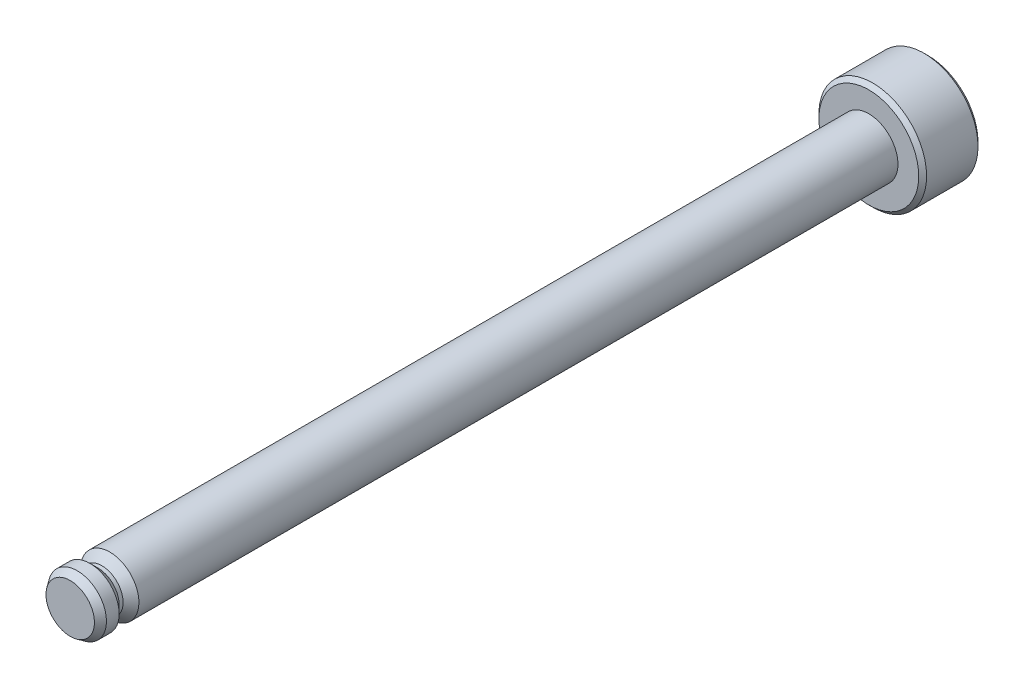
from build123d import *

# Parameters (mm, degrees)
SKETCH2_R      = 1.475
SHAFT_DEPTH    = 40.4
SKETCH5_R      = 2.725
HEAD_DEPTH     = 3
CHAMFER1_SIZE  = 0.25
CHAMFER1_SIZE2 = 0.357037002
DEBURS_SIZE    = 0.2


with BuildPart() as part:
    # Sketch2 → Shaft (new body)
    with BuildSketch(Plane.XY):
        Circle(SKETCH2_R)
    extrude(amount=SHAFT_DEPTH)

    # Sketch5 → Head (add)
    with BuildSketch(Plane.XY):
        Circle(SKETCH5_R)
    extrude(amount=-HEAD_DEPTH)

    # Chamfer1
    chamfer1_edges = [part.edges().sort_by_distance(p)[0] for p in [
        (-1.475, 0, 40.4),
    ]]
    chamfer1_side = [part.faces().sort_by_distance(p)[0] for p in [
        (0, 0, 40.4),
    ]]
    chamfer(chamfer1_edges, length=CHAMFER1_SIZE, length2=CHAMFER1_SIZE2, reference=chamfer1_side[0])

    # Deburs
    deburs_edges = [part.edges().sort_by_distance(p)[0] for p in [
        (-2.725, 0, 0),
        (-2.725, 0, -3),
    ]]
    chamfer(deburs_edges, length=DEBURS_SIZE)

    # Sketch6 → e-Clip Notch Long (revolve, cut)
    with BuildSketch(Plane(origin=(0, 0, 0), x_dir=(0, 0, -1), z_dir=(1, 0, 0))):
        Polygon((-39.4, 1.475), (-38.4, 1.475), (-38.8, 1.075), (-39, 1.075), align=None)
    revolve(axis=Axis((0, 0, 0), (0, 0, 1)), mode=Mode.SUBTRACT)


solid = part.part
